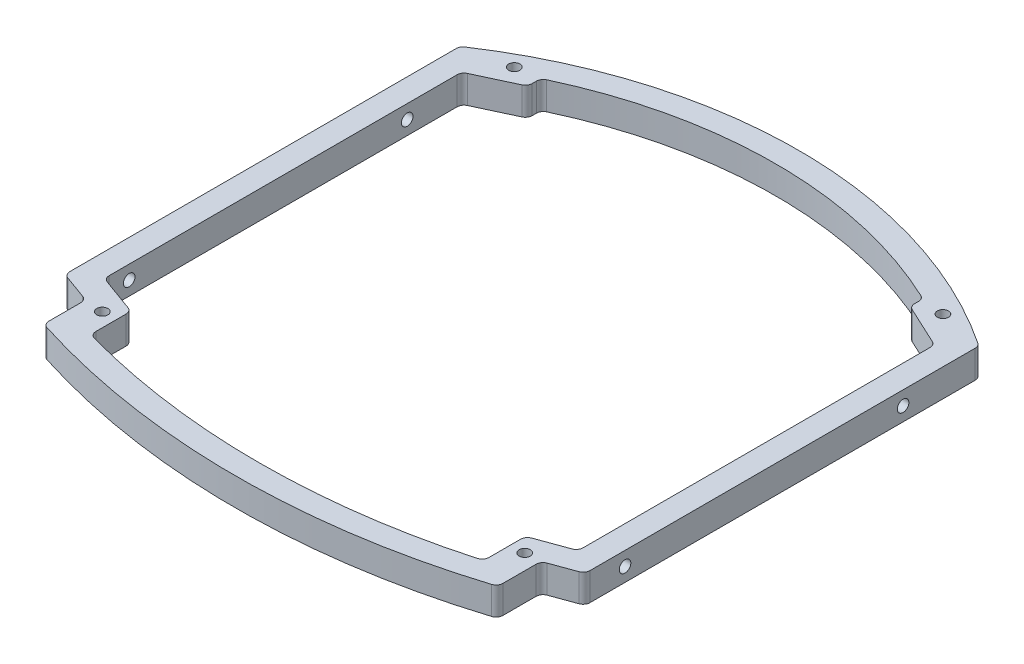
from build123d import *

# Parameters (mm, degrees)
SKETCH1_R                        = 1.2
BOSS_EXTRUDE1_DEPTH              = 6
TAP_DRILL_FOR_M3_TAP1_AT_2_COUNT = 2
TAP_DRILL_FOR_M3_TAP1_AT_2_PITCH = 60
FILLET1_R                        = 1.5


with BuildPart() as part:
    # Sketch1 → Boss-Extrude1 (new body)
    with BuildSketch(Plane(origin=(0, 0, 0), x_dir=(1, 0, 0), z_dir=(0, 1, 0))):
        with BuildLine():
            Line((-56, -47.210505196), (-56, 38))
            ThreePointArc((-56, 38), (0, 55.150739291), (56, 38))
            Line((56, 38), (56, -46.947085848))
            Line((56, -46.947085848), (49, -49.494877488))
            Line((49, -49.494877488), (49, -58.78067695))
            ThreePointArc((49, -58.78067695), (0, -66.468497529), (-49, -58.78067695))
            Line((-49, -58.78067695), (-49, -49.758296835))
            Line((-49, -49.758296835), (-56, -47.210505196))
        make_face()
        with Locations((-46.25, 40)):
            Circle(SKETCH1_R, mode=Mode.SUBTRACT)
        with Locations((46.15, 40.1)):
            Circle(SKETCH1_R, mode=Mode.SUBTRACT)
        with Locations((45.65, -49.65)):
            Circle(SKETCH1_R, mode=Mode.SUBTRACT)
        with Locations((-45, -50.15)):
            Circle(SKETCH1_R, mode=Mode.SUBTRACT)
        with BuildLine():
            Line((-51, -43.709467504), (-51, 33.371526948))
            Line((-51, 33.371526948), (-41.25, 37.918026615))
            Line((-41.25, 37.918026615), (-41.25, 40.727824425))
            ThreePointArc((-41.25, 40.727824425), (-0.055489899, 50.150723085), (41.15, 40.775954619))
            Line((41.15, 40.775954619), (41.15, 38.018026615))
            Line((41.15, 38.018026615), (51, 33.424896182))
            Line((51, 33.424896182), (51, -43.446048157))
            Line((51, -43.446048157), (42.65, -46.485199613))
            Line((42.65, -46.485199613), (42.65, -55.485199613))
            ThreePointArc((42.65, -55.485199613), (0.337839405, -61.46812935), (-42, -55.669703958))
            Line((-42, -55.669703958), (-42, -46.985199613))
            Line((-42, -46.985199613), (-51, -43.709467504))
        make_face(mode=Mode.SUBTRACT)
    extrude(amount=BOSS_EXTRUDE1_DEPTH)

    # Sketch2 → Tap Drill for M3 Tap1 (revolve, cut)
    with BuildSketch(Plane(origin=(-56, 3, -21.65155051), x_dir=(0, 0, 1), z_dir=(0, 1, 0))):
        Polygon((0, 0), (0, 10.751075774), (1.25, 10), (1.25, 0), align=None)
    tap_drill_for_m3_tap1 = revolve(axis=Axis((-62.35, 3, -21.65155051), (1, 0, 0)), mode=Mode.SUBTRACT)

    # Tap Drill for M3 Tap1 at 2: Tap Drill for M3 Tap1 ×2
    with Locations(*[(0, 0, i * TAP_DRILL_FOR_M3_TAP1_AT_2_PITCH) for i in range(1, TAP_DRILL_FOR_M3_TAP1_AT_2_COUNT)]):
        add(tap_drill_for_m3_tap1, mode=Mode.SUBTRACT)

    # Mirror1: Tap Drill for M3 Tap1 across plane
    add(tap_drill_for_m3_tap1.mirror(Plane(origin=(0, 0, 0), x_dir=(0, 0, 1), z_dir=(1, 0, 0))), mode=Mode.SUBTRACT)

    # Mirror1 copy 1 sketch → Mirror1 copy 1 (revolve, cut)
    with BuildSketch(Plane(origin=(56, 3, 38.34844949), x_dir=(0, 0, 1), z_dir=(0, 1, 0))):
        Polygon((0, 0), (0, -10.751075774), (1.25, -10), (1.25, 0), align=None)
    revolve(axis=Axis((62.35, 3, 38.34844949), (1, 0, 0)), mode=Mode.SUBTRACT)

    # Fillet1
    fillet1_edges = [part.edges().sort_by_distance(p)[0] for p in [
        (56, 3, -38),
        (-56, 3, -38),
        (-56, 3, 47.210505196),
        (49, 3, 49.494877488),
        (56, 3, 46.947085848),
        (49, 3, 58.78067695),
        (-49, 3, 58.78067695),
        (-49, 3, 49.758296835),
        (-42, 3, 55.669703958),
        (-42, 3, 46.985199613),
        (-51, 3, 43.709467504),
        (42.65, 3, 55.485199613),
        (42.65, 3, 46.485199613),
        (51, 3, 43.446048157),
        (51, 3, -33.424896182),
        (41.15, 3, -38.018026615),
        (41.15, 3, -40.775954619),
        (-51, 3, -33.371526948),
        (-41.25, 3, -40.727824425),
        (-41.25, 3, -37.918026615),
    ]]
    fillet(fillet1_edges, radius=FILLET1_R)


solid = part.part
